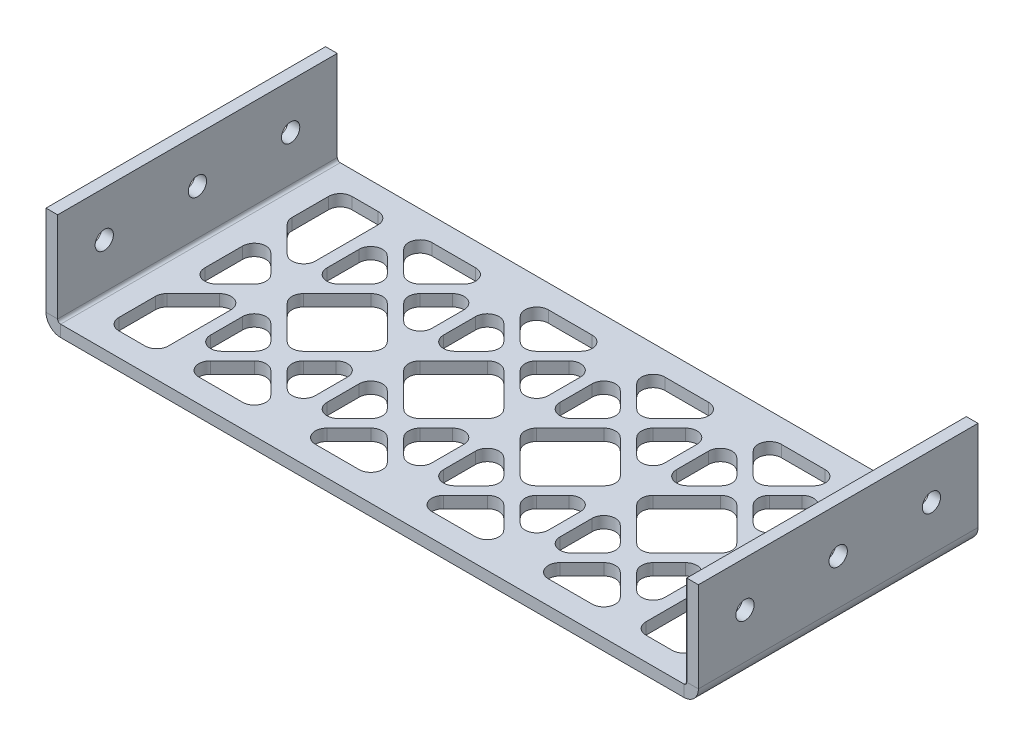
from build123d import *

# Parameters (mm, degrees)
BASE_FLANGE2_DEPTH      = 38.1
CUT_EXTRUDE1_DEPTH      = 181.528835993
CUT_EXTRUDE1_DEPTH_BACK = 181.528835993
SKETCH8_R               = 2.4892
CUT_EXTRUDE2_DEPTH      = 101.853114107
CUT_EXTRUDE2_DEPTH_BACK = 101.853114107
FILLET1_R               = 3.175


# Sheet-metal steps are written as plain solids
with BuildPart() as part:
    # Sketch1 → Base-Flange2 (new, symmetric)
    with BuildSketch(Plane.XY):
        with BuildLine():
            Line((-85.725, 25.4), (-85.725, 0.8128))
            ThreePointArc((-85.725, 0.8128), (-85.486936392, 0.238063608), (-84.9122, 0))
            Line((-84.9122, 0), (84.9122, 0))
            ThreePointArc((84.9122, 0), (85.486936392, 0.238063608), (85.725, 0.8128))
            Line((85.725, 0.8128), (85.725, 25.4))
            Line((85.725, 25.4), (88.9, 25.4))
            Line((88.9, 25.4), (88.9, 0.8128))
            ThreePointArc((88.9, 0.8128), (87.732000422, -2.007000422), (84.9122, -3.175))
            Line((84.9122, -3.175), (-84.9122, -3.175))
            ThreePointArc((-84.9122, -3.175), (-87.732000422, -2.007000422), (-88.9, 0.8128))
            Line((-88.9, 0.8128), (-88.9, 25.4))
            Line((-88.9, 25.4), (-85.725, 25.4))
        make_face()
    extrude(amount=BASE_FLANGE2_DEPTH, both=True)

    # Sketch8 → Cut-Extrude1 (cut, two sides: drawn at the far end of the back side and taken through both)
    with BuildSketch(Plane(origin=(-85.725, 0, 0), x_dir=(0, 0, -1), z_dir=(1, 0, 0)).offset(-CUT_EXTRUDE1_DEPTH_BACK)):
        with Locations((-25.4, 13.1064)):
            Circle(SKETCH8_R)
        with Locations((0, 13.1064)):
            Circle(SKETCH8_R)
        with Locations((25.4, 13.1064)):
            Circle(SKETCH8_R)
    extrude(amount=CUT_EXTRUDE1_DEPTH + CUT_EXTRUDE1_DEPTH_BACK, mode=Mode.SUBTRACT)

    # Sketch9 → Cut-Extrude2 (cut, two sides: drawn at the far end of the back side and taken through both)
    with BuildSketch(Plane.XZ.offset(3.175).offset(-CUT_EXTRUDE2_DEPTH_BACK)):
        Polygon((65.74506403, 0), (78.5622, -12.81713597), (78.5622, 12.81713597), align=None)
        Polygon((65.0875, -3.83256403), (65.0875, -31.75), (78.5622, -31.75), (78.5622, -17.30726403), align=None)
        Polygon((65.0875, 31.75), (65.0875, 3.83256403), (78.5622, 17.30726403), (78.5622, 31.75), align=None)
        Polygon((33.99506403, 0), (47.625, -13.62993597), (61.25493597, 0), (47.625, 13.62993597), align=None)
        Polygon((61.9125, -3.83256403), (49.87006403, -15.875), (61.9125, -27.91743597), align=None)
        Polygon((47.625, -18.12006403), (33.99506403, -31.75), (61.25493597, -31.75), align=None)
        Polygon((61.9125, 27.91743597), (49.87006403, 15.875), (61.9125, 3.83256403), align=None)
        Polygon((33.99506403, 31.75), (47.625, 18.12006403), (61.25493597, 31.75), align=None)
        Polygon((33.3375, 27.91743597), (33.3375, 3.83256403), (45.37993597, 15.875), align=None)
        Polygon((33.3375, -3.83256403), (33.3375, -27.91743597), (45.37993597, -15.875), align=None)
        Polygon((18.12006403, -15.875), (30.1625, -27.91743597), (30.1625, -3.83256403), align=None)
        Polygon((2.24506403, -31.75), (29.50493597, -31.75), (15.875, -18.12006403), align=None)
        Polygon((2.24506403, 0), (15.875, -13.62993597), (29.50493597, 0), (15.875, 13.62993597), align=None)
        Polygon((18.12006403, 15.875), (30.1625, 3.83256403), (30.1625, 27.91743597), align=None)
        Polygon((2.24506403, 31.75), (15.875, 18.12006403), (29.50493597, 31.75), align=None)
        Polygon((1.5875, 27.91743597), (1.5875, 3.83256403), (13.62993597, 15.875), align=None)
        Polygon((1.5875, -27.91743597), (13.62993597, -15.875), (1.5875, -3.83256403), align=None)
        Polygon((-29.50493597, -31.75), (-2.24506403, -31.75), (-15.875, -18.12006403), align=None)
        Polygon((-29.50493597, 0), (-15.875, -13.62993597), (-2.24506403, 0), (-15.875, 13.62993597), align=None)
        Polygon((-13.62993597, -15.875), (-1.5875, -27.91743597), (-1.5875, -3.83256403), align=None)
        Polygon((-13.62993597, 15.875), (-1.5875, 3.83256403), (-1.5875, 27.91743597), align=None)
        Polygon((-29.50493597, 31.75), (-15.875, 18.12006403), (-2.24506403, 31.75), align=None)
        Polygon((-30.1625, 27.91743597), (-30.1625, 3.83256403), (-18.12006403, 15.875), align=None)
        Polygon((-45.37993597, 15.875), (-33.3375, 3.83256403), (-33.3375, 27.91743597), align=None)
        Polygon((-61.25493597, 0), (-47.625, -13.62993597), (-33.99506403, 0), (-47.625, 13.62993597), align=None)
        Polygon((-45.37993597, -15.875), (-33.3375, -27.91743597), (-33.3375, -3.83256403), align=None)
        Polygon((-30.1625, -27.91743597), (-18.12006403, -15.875), (-30.1625, -3.83256403), align=None)
        Polygon((-61.25493597, -31.75), (-33.99506403, -31.75), (-47.625, -18.12006403), align=None)
        Polygon((-61.9125, -27.91743597), (-49.87006403, -15.875), (-61.9125, -3.83256403), align=None)
        Polygon((-61.9125, 27.91743597), (-61.9125, 3.83256403), (-49.87006403, 15.875), align=None)
        Polygon((-61.25493597, 31.75), (-47.625, 18.12006403), (-33.99506403, 31.75), align=None)
        Polygon((-78.5622, 17.30726403), (-65.0875, 3.83256403), (-65.0875, 31.75), (-78.5622, 31.75), align=None)
        Polygon((-78.5622, 12.81713597), (-78.5622, -12.81713597), (-65.74506403, 0), align=None)
        Polygon((-78.5622, -31.75), (-65.0875, -31.75), (-65.0875, -3.83256403), (-78.5622, -17.30726403), align=None)
    extrude(amount=CUT_EXTRUDE2_DEPTH + CUT_EXTRUDE2_DEPTH_BACK, mode=Mode.SUBTRACT)

    # Fillet1
    fillet1_edges = [part.edges().sort_by_distance(p)[0] for p in [
        (29.50493597, -1.5875, 0),
        (15.875, -1.5875, -13.62993597),
        (2.24506403, -1.5875, 0),
        (15.875, -1.5875, 13.62993597),
        (15.875, -1.5875, -18.12006403),
        (29.50493597, -1.5875, -31.75),
        (2.24506403, -1.5875, -31.75),
        (30.1625, -1.5875, -3.83256403),
        (30.1625, -1.5875, -27.91743597),
        (18.12006403, -1.5875, -15.875),
        (45.37993597, -1.5875, -15.875),
        (33.3375, -1.5875, -27.91743597),
        (33.3375, -1.5875, -3.83256403),
        (13.62993597, -1.5875, -15.875),
        (1.5875, -1.5875, -27.91743597),
        (1.5875, -1.5875, -3.83256403),
        (13.62993597, -1.5875, 15.875),
        (1.5875, -1.5875, 3.83256403),
        (1.5875, -1.5875, 27.91743597),
        (30.1625, -1.5875, 27.91743597),
        (30.1625, -1.5875, 3.83256403),
        (18.12006403, -1.5875, 15.875),
        (15.875, -1.5875, 18.12006403),
        (2.24506403, -1.5875, 31.75),
        (29.50493597, -1.5875, 31.75),
        (78.5622, -1.5875, -17.30726403),
        (78.5622, -1.5875, -31.75),
        (65.0875, -1.5875, -31.75),
        (65.0875, -1.5875, -3.83256403),
        (78.5622, -1.5875, 17.30726403),
        (65.0875, -1.5875, 3.83256403),
        (65.0875, -1.5875, 31.75),
        (78.5622, -1.5875, 31.75),
        (61.9125, -1.5875, -3.83256403),
        (61.9125, -1.5875, -27.91743597),
        (49.87006403, -1.5875, -15.875),
        (61.25493597, -1.5875, 0),
        (47.625, -1.5875, -13.62993597),
        (33.99506403, -1.5875, 0),
        (47.625, -1.5875, 13.62993597),
        (47.625, -1.5875, 18.12006403),
        (33.99506403, -1.5875, 31.75),
        (61.25493597, -1.5875, 31.75),
        (45.37993597, -1.5875, 15.875),
        (33.3375, -1.5875, 3.83256403),
        (33.3375, -1.5875, 27.91743597),
        (61.9125, -1.5875, 27.91743597),
        (61.9125, -1.5875, 3.83256403),
        (49.87006403, -1.5875, 15.875),
        (47.625, -1.5875, -18.12006403),
        (61.25493597, -1.5875, -31.75),
        (33.99506403, -1.5875, -31.75),
        (-47.625, -1.5875, -18.12006403),
        (-33.99506403, -1.5875, -31.75),
        (-61.25493597, -1.5875, -31.75),
        (-49.87006403, -1.5875, -15.875),
        (-61.9125, -1.5875, -27.91743597),
        (-61.9125, -1.5875, -3.83256403),
        (-18.12006403, -1.5875, -15.875),
        (-30.1625, -1.5875, -27.91743597),
        (-30.1625, -1.5875, -3.83256403),
        (-33.3375, -1.5875, -27.91743597),
        (-45.37993597, -1.5875, -15.875),
        (-33.3375, -1.5875, -3.83256403),
        (-47.625, -1.5875, 18.12006403),
        (-61.25493597, -1.5875, 31.75),
        (-33.99506403, -1.5875, 31.75),
        (-49.87006403, -1.5875, 15.875),
        (-61.9125, -1.5875, 3.83256403),
        (-61.9125, -1.5875, 27.91743597),
        (-65.74506403, -1.5875, 0),
        (-78.5622, -1.5875, -12.81713597),
        (-78.5622, -1.5875, 12.81713597),
        (-65.0875, -1.5875, 3.83256403),
        (-78.5622, -1.5875, 17.30726403),
        (-78.5622, -1.5875, 31.75),
        (-65.0875, -1.5875, 31.75),
        (-1.5875, -1.5875, 3.83256403),
        (-13.62993597, -1.5875, 15.875),
        (-1.5875, -1.5875, 27.91743597),
        (-1.5875, -1.5875, -27.91743597),
        (-13.62993597, -1.5875, -15.875),
        (-1.5875, -1.5875, -3.83256403),
        (-2.24506403, -1.5875, 0),
        (-15.875, -1.5875, -13.62993597),
        (-29.50493597, -1.5875, 0),
        (-15.875, -1.5875, 13.62993597),
        (-15.875, -1.5875, -18.12006403),
        (-2.24506403, -1.5875, -31.75),
        (-29.50493597, -1.5875, -31.75),
        (-18.12006403, -1.5875, 15.875),
        (-30.1625, -1.5875, 3.83256403),
        (-30.1625, -1.5875, 27.91743597),
        (-15.875, -1.5875, 18.12006403),
        (-29.50493597, -1.5875, 31.75),
        (-2.24506403, -1.5875, 31.75),
        (-33.99506403, -1.5875, 0),
        (-47.625, -1.5875, -13.62993597),
        (-61.25493597, -1.5875, 0),
        (-47.625, -1.5875, 13.62993597),
        (-33.3375, -1.5875, 3.83256403),
        (-45.37993597, -1.5875, 15.875),
        (-33.3375, -1.5875, 27.91743597),
        (-65.0875, -1.5875, -31.75),
        (-78.5622, -1.5875, -31.75),
        (-78.5622, -1.5875, -17.30726403),
        (-65.0875, -1.5875, -3.83256403),
        (78.5622, -1.5875, 12.81713597),
        (78.5622, -1.5875, -12.81713597),
        (65.74506403, -1.5875, 0),
    ]]
    fillet(fillet1_edges, radius=FILLET1_R)


solid = part.part
